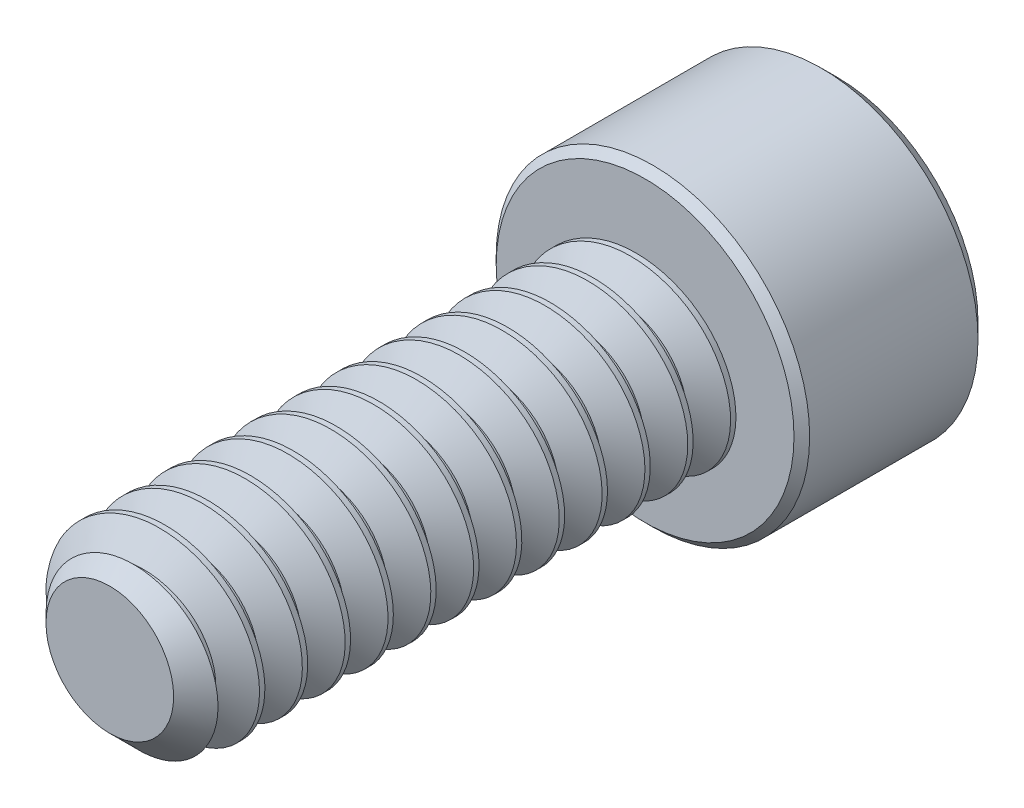
from build123d import *

# Parameters (mm, degrees)
SKETCH1_R          = 1.4224
EXTRUDE1_DEPTH     = 7.9375
CHAMFER3_SIZE      = 0.47625
CUT_SWEEP1_PITCH   = 0.635
SKETCH6_R          = 2.3241
EXTRUDE2_DEPTH     = 2.8448
CUT_EXTRUDE1_DEPTH = 1.7859375
CHAMFER1_SIZE      = 0.23241
CHAMFER2_SIZE      = 0.116205


with BuildPart() as part:
    # Sketch1 → Extrude1 (new body)
    with BuildSketch(Plane.XY):
        Circle(SKETCH1_R)
    extrude(amount=-EXTRUDE1_DEPTH)

    # Chamfer3
    chamfer3_edges = [part.edges().sort_by_distance(p)[0] for p in [
        (-1.4224, 0, 0),
    ]]
    chamfer(chamfer3_edges, length=CHAMFER3_SIZE)

    # Cut-Sweep1: the profile of Sketch3 profile screwed along a right-hand helix of 13.5 turns, 6 arcs to a turn; built about Z, then put on its axis
    cut_sweep1_z = Axis((0, 0, 0), (0, 0, 1))
    cut_sweep1_corners = [(1.4227, 0, -0.555798205), (1.009955401, 0, -0.3175), (1.009955401, 0, -0.238125), (1.4227, 0, 0.000173205)]
    with BuildLine(mode=Mode.PRIVATE) as cut_sweep1_profile:
        Line(cut_sweep1_corners[0], cut_sweep1_corners[1])
        Line(cut_sweep1_corners[1], cut_sweep1_corners[2])
        Line(cut_sweep1_corners[2], cut_sweep1_corners[3])
        Line(cut_sweep1_corners[3], cut_sweep1_corners[0])
    cut_sweep1_cap = Face(cut_sweep1_profile.wire())
    cut_sweep1_turn_angles = [0, 30, 60, 90, 120, 150, 180, 210, 240, 270, 300, 330, 360]
    cut_sweep1_turn_weights = [1, 0.8660254037844387, 1, 0.8660254037844387, 1, 0.8660254037844387, 1, 0.8660254037844387, 1, 0.8660254037844387, 1, 0.8660254037844387, 1]
    cut_sweep1_turn_rails = [Edge.make_bspline([Vector(p[0], p[1], 0).rotate(cut_sweep1_z, cut_sweep1_turn_angles[k]) / cut_sweep1_turn_weights[k] + Vector(0, 0, p[2] + CUT_SWEEP1_PITCH * cut_sweep1_turn_angles[k] / 360) for k in range(13)], [0, 0, 0, 1, 1, 2, 2, 3, 3, 4, 4, 5, 5, 6, 6, 6], 2, cut_sweep1_turn_weights) for p in cut_sweep1_corners]
    cut_sweep1_turn_sides = [Face.make_surface_from_curves(cut_sweep1_turn_rails[p[0]], cut_sweep1_turn_rails[p[1]]) for p in [(0, 1), (1, 2), (2, 3), (3, 0)]]
    cut_sweep1_last_angles = [4680, 4710, 4740, 4770, 4800, 4830, 4860]
    cut_sweep1_last_weights = [1, 0.8660254037844387, 1, 0.8660254037844387, 1, 0.8660254037843632, 1]
    cut_sweep1_last_rails = [Edge.make_bspline([Vector(p[0], p[1], 0).rotate(cut_sweep1_z, cut_sweep1_last_angles[k]) / cut_sweep1_last_weights[k] + Vector(0, 0, p[2] + CUT_SWEEP1_PITCH * cut_sweep1_last_angles[k] / 360) for k in range(7)], [0, 0, 0, 1, 1, 2, 2, 3, 3, 3], 2, cut_sweep1_last_weights) for p in cut_sweep1_corners]
    cut_sweep1_last_sides = [Face.make_surface_from_curves(cut_sweep1_last_rails[p[0]], cut_sweep1_last_rails[p[1]]) for p in [(0, 1), (1, 2), (2, 3), (3, 0)]]
    cut_sweep1 = Plane(origin=(0, 0, 0), x_dir=(0, 1, 0), z_dir=(0, 0, -1)) * Solid(Shell([*[p.moved(Location((0, 0, CUT_SWEEP1_PITCH * i))) for i in range(13) for p in cut_sweep1_turn_sides], *cut_sweep1_last_sides, cut_sweep1_cap, cut_sweep1_cap.rotate(cut_sweep1_z, 4860).moved(Location((0, 0, CUT_SWEEP1_PITCH * 4860 / 360)))]))
    add(cut_sweep1, mode=Mode.SUBTRACT)

    # Sketch6 → Extrude2 (add)
    with BuildSketch(Plane(origin=(0, 0, -7.9375), x_dir=(-1, 0, 0), z_dir=(0, 0, -1))):
        Circle(SKETCH6_R)
    extrude(amount=EXTRUDE2_DEPTH)

    # Sketch7 → Cut-Extrude1 (cut)
    with BuildSketch(Plane(origin=(0, 0, -10.7823), x_dir=(-1, 0, 0), z_dir=(0, 0, -1))):
        Polygon((0, 1.374815329), (-1.190625, 0.687407664), (-1.190625, -0.687407664), (0, -1.374815329), (1.190625, -0.687407664), (1.190625, 0.687407664), align=None)
    extrude(amount=-CUT_EXTRUDE1_DEPTH, mode=Mode.SUBTRACT)

    # Cut-Extrude2 cone 1 section (through the dimple's axis) → Cut-Extrude2 (revolve, cut)
    with BuildSketch(Plane(origin=(0, 0, -10.7823), x_dir=(0, 1, 0), z_dir=(1, 0, 0))):
        Polygon((0, 0), (1.374815329, 0), (0, 1.374815329), align=None)
    revolve(axis=Axis((0, 0, -10.7823), (0, 0, 1)), mode=Mode.SUBTRACT)

    # Chamfer1
    chamfer1_edges = [part.edges().sort_by_distance(p)[0] for p in [
        (2.3241, 0, -10.7823),
    ]]
    chamfer(chamfer1_edges, length=CHAMFER1_SIZE)

    # Chamfer2
    chamfer2_edges = [part.edges().sort_by_distance(p)[0] for p in [
        (2.3241, 0, -7.9375),
    ]]
    chamfer(chamfer2_edges, length=CHAMFER2_SIZE)


solid = part.part
